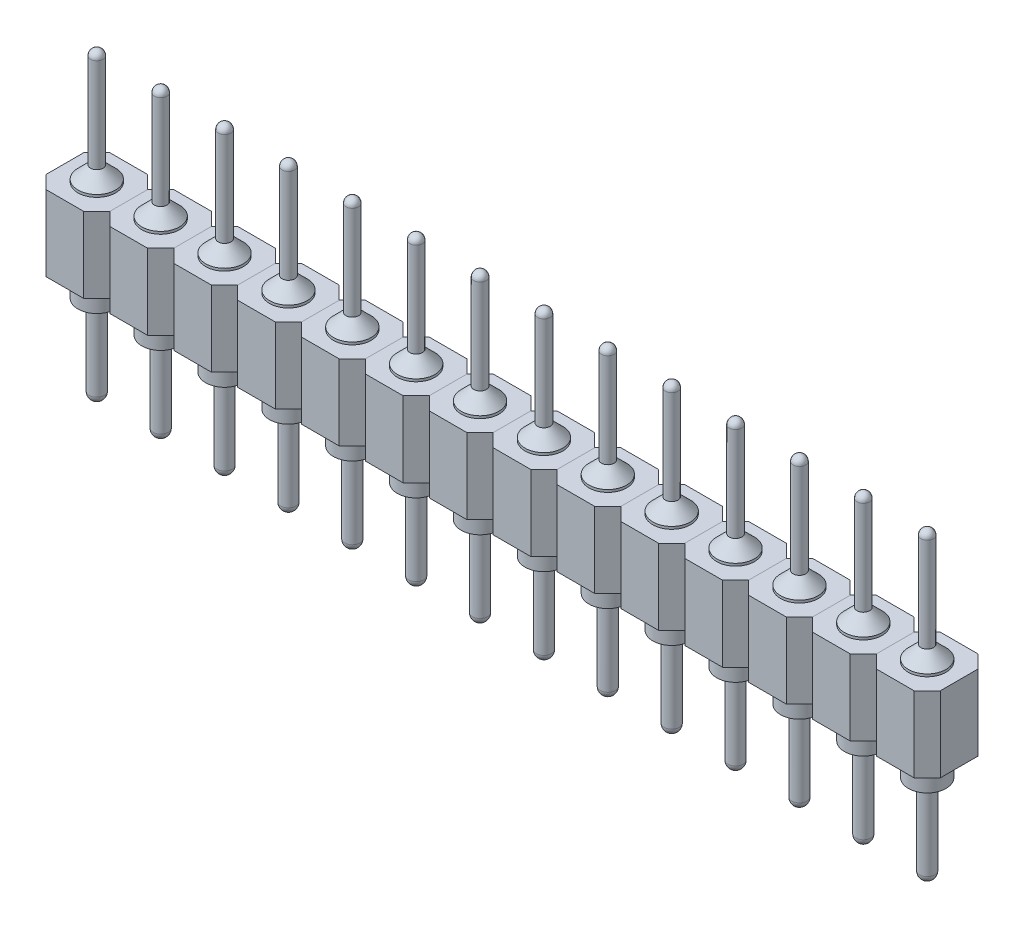
from build123d import *
from build123d.topology import SkipClean

# Parameters (mm, degrees)
EXTRUDE_START          = -1
SKETCH_3_R             = 0.75
EXTRUDE_1_DEPTH        = 3
PATTERN_LINEAR_1_COUNT = 14
PATTERN_LINEAR_1_PITCH = 2.54


with BuildPart() as part:
    # Эскиз2 → Повернуть1 (revolve)
    with SkipClean():  # the faces are left unmerged after this step: merging them gives an invalid solid
        with BuildSketch(Plane.XY):
            with BuildLine():
                Line((0, 11.6), (0, 0.6))
                ThreePointArc((0, 0.6), (0.212132034, 0.512132034), (0.3, 0.3))
                Line((0.3, 0.3), (0.3, 3.5))
                Line((0.3, 3.5), (0.75, 3.5))
                Line((0.75, 3.5), (0.75, 7.6))
                Line((0.75, 7.6), (0.25, 8.1))
                Line((0.25, 8.1), (0.25, 11.85))
                ThreePointArc((0.25, 11.85), (0.176776695, 11.673223305), (0, 11.6))
            make_face()
            with BuildLine():
                ThreePointArc((0, 0.6), (-0.3, 0.3), (0, 0))
                Line((0, 0), (0, 0.6))
            make_face()
            with BuildLine():
                Line((0, 0.6), (0, 0))
                ThreePointArc((0, 0), (0.212132034, 0.087867966), (0.3, 0.3))
                ThreePointArc((0.3, 0.3), (0.212132034, 0.512132034), (0, 0.6))
            make_face()
            with BuildLine():
                ThreePointArc((0, 12.1), (-0.25, 11.85), (0, 11.6))
                Line((0, 11.6), (0, 12.1))
            make_face()
            with BuildLine():
                Line((0, 12.1), (0, 11.6))
                ThreePointArc((0, 11.6), (0.176776695, 11.673223305), (0.25, 11.85))
                ThreePointArc((0.25, 11.85), (0.176776695, 12.026776695), (0, 12.1))
            make_face()
        revolve(axis=Axis((0, 0, 0), (0, 1, 0)))
    add(part.part.scale(1), mode=Mode.REPLACE)  # the faces are merged on a copy


with BuildPart() as body_2:
    # Эскиз3 → Бобышка-Вытянуть1 (new body)
    with BuildSketch(Plane.XZ.offset(-3.5).offset(EXTRUDE_START)):
        Polygon((-0.75, 1.27), (0.75, 1.27), (1.27, 0.75), (1.27, -0.75), (0.75, -1.27), (-0.75, -1.27), (-1.27, -0.75), (-1.27, 0.75), align=None)
        Circle(SKETCH_3_R, mode=Mode.SUBTRACT)
    extrude(amount=-EXTRUDE_1_DEPTH)


with BuildPart() as pattern_linear_1_1:
    # Линейный массив1: pattern copy
    add(body_2.part.moved(Location(Vector(-1, 0, 0) * (1 * PATTERN_LINEAR_1_PITCH))))


with BuildPart() as pattern_linear_1_2:
    # Линейный массив1: pattern copy
    add(body_2.part.moved(Location(Vector(-1, 0, 0) * (2 * PATTERN_LINEAR_1_PITCH))))


with BuildPart() as pattern_linear_1_3:
    # Линейный массив1: pattern copy
    add(body_2.part.moved(Location(Vector(-1, 0, 0) * (3 * PATTERN_LINEAR_1_PITCH))))


with BuildPart() as pattern_linear_1_4:
    # Линейный массив1: pattern copy
    add(body_2.part.moved(Location(Vector(-1, 0, 0) * (4 * PATTERN_LINEAR_1_PITCH))))


with BuildPart() as pattern_linear_1_5:
    # Линейный массив1: pattern copy
    add(body_2.part.moved(Location(Vector(-1, 0, 0) * (5 * PATTERN_LINEAR_1_PITCH))))


with BuildPart() as pattern_linear_1_6:
    # Линейный массив1: pattern copy
    add(body_2.part.moved(Location(Vector(-1, 0, 0) * (6 * PATTERN_LINEAR_1_PITCH))))


with BuildPart() as pattern_linear_1_7:
    # Линейный массив1: pattern copy
    add(body_2.part.moved(Location(Vector(-1, 0, 0) * (7 * PATTERN_LINEAR_1_PITCH))))


with BuildPart() as pattern_linear_1_8:
    # Линейный массив1: pattern copy
    add(body_2.part.moved(Location(Vector(-1, 0, 0) * (8 * PATTERN_LINEAR_1_PITCH))))


with BuildPart() as pattern_linear_1_9:
    # Линейный массив1: pattern copy
    add(body_2.part.moved(Location(Vector(-1, 0, 0) * (9 * PATTERN_LINEAR_1_PITCH))))


with BuildPart() as pattern_linear_1_10:
    # Линейный массив1: pattern copy
    add(body_2.part.moved(Location(Vector(-1, 0, 0) * (10 * PATTERN_LINEAR_1_PITCH))))


with BuildPart() as pattern_linear_1_11:
    # Линейный массив1: pattern copy
    add(body_2.part.moved(Location(Vector(-1, 0, 0) * (11 * PATTERN_LINEAR_1_PITCH))))


with BuildPart() as pattern_linear_1_12:
    # Линейный массив1: pattern copy
    add(body_2.part.moved(Location(Vector(-1, 0, 0) * (12 * PATTERN_LINEAR_1_PITCH))))


with BuildPart() as pattern_linear_1_13:
    # Линейный массив1: pattern copy
    add(body_2.part.moved(Location(Vector(-1, 0, 0) * (13 * PATTERN_LINEAR_1_PITCH))))


with BuildPart() as pattern_linear_1_14:
    # Линейный массив1: pattern copy
    add(part.part.moved(Location(Vector(-1, 0, 0) * (1 * PATTERN_LINEAR_1_PITCH))))


with BuildPart() as pattern_linear_1_15:
    # Линейный массив1: pattern copy
    add(part.part.moved(Location(Vector(-1, 0, 0) * (2 * PATTERN_LINEAR_1_PITCH))))


with BuildPart() as pattern_linear_1_16:
    # Линейный массив1: pattern copy
    add(part.part.moved(Location(Vector(-1, 0, 0) * (3 * PATTERN_LINEAR_1_PITCH))))


with BuildPart() as pattern_linear_1_17:
    # Линейный массив1: pattern copy
    add(part.part.moved(Location(Vector(-1, 0, 0) * (4 * PATTERN_LINEAR_1_PITCH))))


with BuildPart() as pattern_linear_1_18:
    # Линейный массив1: pattern copy
    add(part.part.moved(Location(Vector(-1, 0, 0) * (5 * PATTERN_LINEAR_1_PITCH))))


with BuildPart() as pattern_linear_1_19:
    # Линейный массив1: pattern copy
    add(part.part.moved(Location(Vector(-1, 0, 0) * (6 * PATTERN_LINEAR_1_PITCH))))


with BuildPart() as pattern_linear_1_20:
    # Линейный массив1: pattern copy
    add(part.part.moved(Location(Vector(-1, 0, 0) * (7 * PATTERN_LINEAR_1_PITCH))))


with BuildPart() as pattern_linear_1_21:
    # Линейный массив1: pattern copy
    add(part.part.moved(Location(Vector(-1, 0, 0) * (8 * PATTERN_LINEAR_1_PITCH))))


with BuildPart() as pattern_linear_1_22:
    # Линейный массив1: pattern copy
    add(part.part.moved(Location(Vector(-1, 0, 0) * (9 * PATTERN_LINEAR_1_PITCH))))


with BuildPart() as pattern_linear_1_23:
    # Линейный массив1: pattern copy
    add(part.part.moved(Location(Vector(-1, 0, 0) * (10 * PATTERN_LINEAR_1_PITCH))))


with BuildPart() as pattern_linear_1_24:
    # Линейный массив1: pattern copy
    add(part.part.moved(Location(Vector(-1, 0, 0) * (11 * PATTERN_LINEAR_1_PITCH))))


with BuildPart() as pattern_linear_1_25:
    # Линейный массив1: pattern copy
    add(part.part.moved(Location(Vector(-1, 0, 0) * (12 * PATTERN_LINEAR_1_PITCH))))


with BuildPart() as pattern_linear_1_26:
    # Линейный массив1: pattern copy
    add(part.part.moved(Location(Vector(-1, 0, 0) * (13 * PATTERN_LINEAR_1_PITCH))))


solid = Compound([part.part, body_2.part, pattern_linear_1_1.part, pattern_linear_1_2.part, pattern_linear_1_3.part, pattern_linear_1_4.part, pattern_linear_1_5.part, pattern_linear_1_6.part, pattern_linear_1_7.part, pattern_linear_1_8.part, pattern_linear_1_9.part, pattern_linear_1_10.part, pattern_linear_1_11.part, pattern_linear_1_12.part, pattern_linear_1_13.part, pattern_linear_1_14.part, pattern_linear_1_15.part, pattern_linear_1_16.part, pattern_linear_1_17.part, pattern_linear_1_18.part, pattern_linear_1_19.part, pattern_linear_1_20.part, pattern_linear_1_21.part, pattern_linear_1_22.part, pattern_linear_1_23.part, pattern_linear_1_24.part, pattern_linear_1_25.part, pattern_linear_1_26.part])
